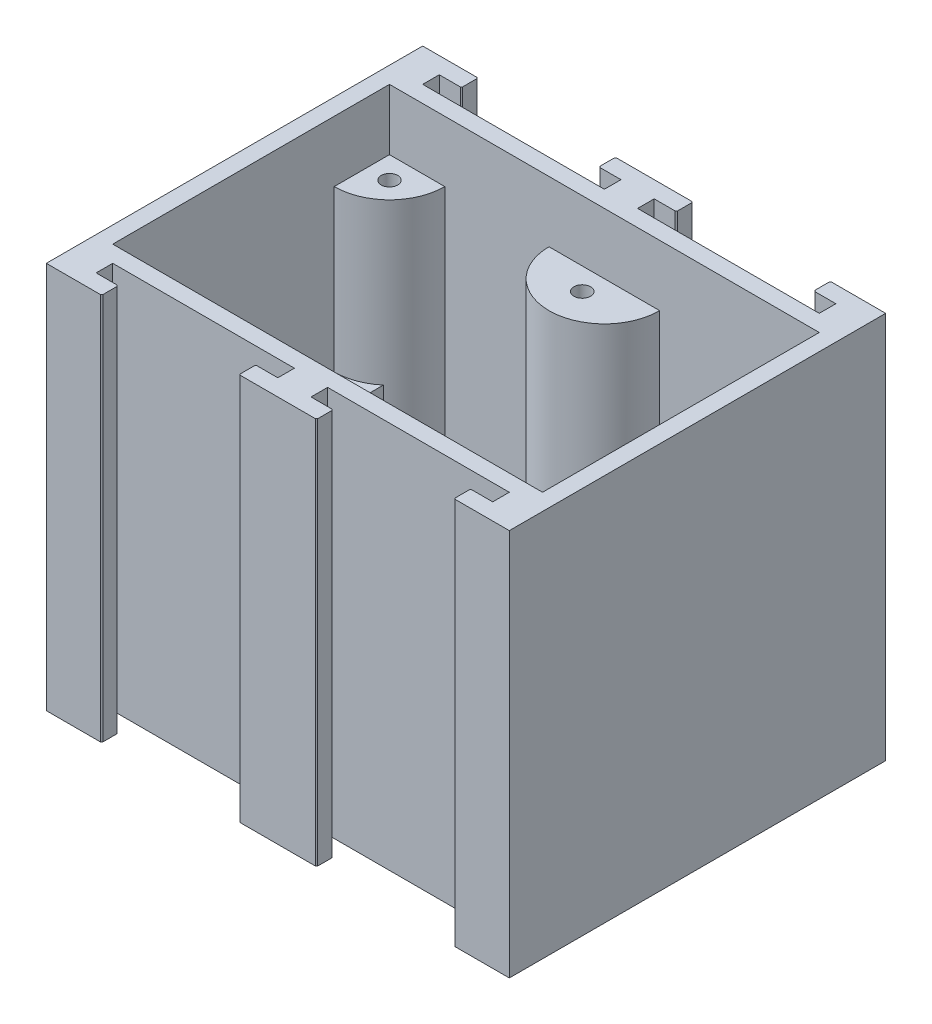
from build123d import *

# Parameters (mm, degrees)
SKETCH1_R             = 1.5
BOSS_EXTRUDE6_DEPTH   = 59
BOSS_EXTRUDE6_2_DEPTH = 59
BOSS_EXTRUDE6_3_DEPTH = 59
BOSS_EXTRUDE6_4_DEPTH = 59
BOSS_EXTRUDE6_5_DEPTH = 59
BOSS_EXTRUDE6_6_DEPTH = 59
SKETCH2_W             = 83.65
SKETCH2_H             = 56
SKETCH2_W_2           = 77.65
SKETCH2_H_2           = 50
BOSS_EXTRUDE7_DEPTH   = 70
SKETCH3_R             = 2.1
SKETCH3_W             = 8
SKETCH3_H             = 50
BOSS_EXTRUDE8_DEPTH   = 30
CHAMFER1_SIZE         = 3
FILLET1_R             = 3
SKETCH4_R             = 2.1
CUT_EXTRUDE2_DEPTH    = 16
FILLET2_R             = 1.3
SKETCH5_W             = 8.8
SKETCH5_H             = 12
CUT_EXTRUDE3_DEPTH    = 10
FILLET3_R             = 0.6
SKETCH6_W             = 6
SKETCH6_H             = 6
BOSS_EXTRUDE9_DEPTH   = 70
CHAMFER3_SIZE         = 0.2


with BuildPart() as part:
    # Sketch1 → Boss-Extrude6 (new body)
    with BuildSketch(Plane(origin=(0, 0, 0), x_dir=(1, 0, 0), z_dir=(0, 1, 0))):
        with BuildLine():
            Line((-38.825, 15), (-38.825, 25))
            Line((-38.825, 25), (-28.825, 25))
            ThreePointArc((-28.825, 25), (-31.753932188, 17.928932188), (-38.825, 15))
        make_face()
        with Locations(Location((-34.825, 21, 0), (0, 0, 270))):
            Circle(SKETCH1_R, mode=Mode.SUBTRACT)
    extrude(amount=BOSS_EXTRUDE6_DEPTH)



with BuildPart() as body_2:
    # Sketch1 → Boss-Extrude6 2 (new body)
    with BuildSketch(Plane(origin=(0, 0, 0), x_dir=(1, 0, 0), z_dir=(0, 1, 0))):
        with BuildLine():
            Line((-38.825, -25), (-28.825, -25))
            ThreePointArc((-28.825, -25), (-31.753932188, -17.928932188), (-38.825, -15))
            Line((-38.825, -15), (-38.825, -25))
        make_face()
        with Locations(Location((-34.825, -21, 0), (0, 0, 270))):
            Circle(SKETCH1_R, mode=Mode.SUBTRACT)
    extrude(amount=BOSS_EXTRUDE6_2_DEPTH)


with BuildPart() as body_3:
    # Sketch1 → Boss-Extrude6 3 (new body)
    with BuildSketch(Plane(origin=(0, 0, 0), x_dir=(1, 0, 0), z_dir=(0, 1, 0))):
        with BuildLine():
            Line((38.825, -25), (38.825, -15))
            ThreePointArc((38.825, -15), (31.753932188, -17.928932188), (28.825, -25))
            Line((28.825, -25), (38.825, -25))
        make_face()
        with Locations(Location((34.825, -21, 0), (0, 0, 270))):
            Circle(SKETCH1_R, mode=Mode.SUBTRACT)
    extrude(amount=BOSS_EXTRUDE6_3_DEPTH)


with BuildPart() as body_4:
    # Sketch1 → Boss-Extrude6 4 (new body)
    with BuildSketch(Plane(origin=(0, 0, 0), x_dir=(1, 0, 0), z_dir=(0, 1, 0))):
        with BuildLine():
            Line((28.825, 25), (38.825, 25))
            Line((38.825, 25), (38.825, 15))
            ThreePointArc((38.825, 15), (31.753932188, 17.928932188), (28.825, 25))
        make_face()
        with Locations(Location((34.825, 21, 0), (0, 0, 270))):
            Circle(SKETCH1_R, mode=Mode.SUBTRACT)
    extrude(amount=BOSS_EXTRUDE6_4_DEPTH)


with BuildPart() as body_5:
    # Sketch1 → Boss-Extrude6 5 (new body)
    with BuildSketch(Plane(origin=(0, 0, 0), x_dir=(1, 0, 0), z_dir=(0, 1, 0))):
        with BuildLine():
            Line((10, -25), (-10, -25))
            ThreePointArc((-10, -25), (0, -15), (10, -25))
        make_face()
        with Locations(Location((0, -21, 0), (0, 0, 270))):
            Circle(SKETCH1_R, mode=Mode.SUBTRACT)
    extrude(amount=BOSS_EXTRUDE6_5_DEPTH)


with BuildPart() as body_6:
    # Sketch1 → Boss-Extrude6 6 (new body)
    with BuildSketch(Plane(origin=(0, 0, 0), x_dir=(1, 0, 0), z_dir=(0, 1, 0))):
        with BuildLine():
            Line((10, 25), (-10, 25))
            ThreePointArc((-10, 25), (0, 15), (10, 25))
        make_face()
        with Locations(Location((0, 21, 0), (0, 0, 270))):
            Circle(SKETCH1_R, mode=Mode.SUBTRACT)
    extrude(amount=BOSS_EXTRUDE6_6_DEPTH)


with BuildPart() as part_1:
    add(part.part)

    add(body_2.part)  # Boss-Extrude7 merges body 2

    add(body_3.part)  # Boss-Extrude7 merges body 3

    add(body_4.part)  # Boss-Extrude7 merges body 4

    add(body_5.part)  # Boss-Extrude7 merges body 5

    add(body_6.part)  # Boss-Extrude7 merges body 6
    # Sketch2 → Boss-Extrude7 (add)
    with BuildSketch(Plane(origin=(0, 0, 0), x_dir=(1, 0, 0), z_dir=(0, 1, 0))):
        Rectangle(SKETCH2_W, SKETCH2_H)
        Rectangle(SKETCH2_W_2, SKETCH2_H_2, mode=Mode.SUBTRACT)
    extrude(amount=BOSS_EXTRUDE7_DEPTH)

    # Sketch3 → Boss-Extrude8 (add)
    # profile 1 of 2: a face of its own
    with BuildSketch(Plane(origin=(0, 0, 0), x_dir=(1, 0, 0), z_dir=(0, 1, 0))):
        Polygon((-38.825, 0), (-38.825, 19), (-32.325, 19), (-32.325, -19), (-38.825, -19), align=None)
        with Locations(Location((-35.925, 4.8, 0), (0, 0, 270))):
            Circle(SKETCH3_R, mode=Mode.SUBTRACT)
        with Locations(Location((-35.925, -4.8, 0), (0, 0, 90))):
            Circle(SKETCH3_R, mode=Mode.SUBTRACT)
    # profile 2 of 2: a face of its own
    with BuildSketch(Plane(origin=(0, 0, 0), x_dir=(1, 0, 0), z_dir=(0, 1, 0))):
        with Locations((13.299000327, 0)):
            Rectangle(SKETCH3_W, SKETCH3_H)
        with Locations(Location((12.899000327, -4.8, 0), (0, 0, 270))):
            Circle(SKETCH3_R, mode=Mode.SUBTRACT)
        with Locations(Location((12.899000327, 4.8, 0), (0, 0, 90))):
            Circle(SKETCH3_R, mode=Mode.SUBTRACT)
    extrude(amount=BOSS_EXTRUDE8_DEPTH)

    # Chamfer1
    chamfer1_edges = [part_1.edges().sort_by_distance(p)[0] for p in [
        (13.649500163, 30, 25),
        (13.649500163, 30, -25),
        (17.299000327, 15, -25),
        (17.299000327, 15, 25),
    ]]
    chamfer(chamfer1_edges, length=CHAMFER1_SIZE)

    # Fillet1
    fillet1_edges = [part_1.edges().sort_by_distance(p)[0] for p in [
        (9.299000327, 15, -21.32187644),
        (9.299000327, 15, 21.32187644),
    ]]
    fillet(fillet1_edges, radius=FILLET1_R)

    # Sketch4 → Cut-Extrude2 (cut)
    # profile 1 of 4: a face of its own
    with BuildSketch(Plane.XZ):
        Polygon((-32.325, 4.035382907), (-32.325, 5.564617093), (-33.904274058, 8.3), (-37.945725942, 8.3), (-39.966451884, 4.8), (-37.945725942, 1.3), (-33.904274058, 1.3), align=None)
        with Locations(Location((-35.925, 4.8, 0), (0, 0, 270))):
            Circle(SKETCH4_R, mode=Mode.SUBTRACT)
    # profile 2 of 4: a face of its own
    with BuildSketch(Plane.XZ):
        Polygon((-32.325, -5.564617093), (-32.325, -4.035382907), (-33.904274058, -1.3), (-37.945725942, -1.3), (-39.966451884, -4.8), (-37.945725942, -8.3), (-33.904274058, -8.3), align=None)
        with Locations(Location((-35.925, -4.8, 0), (0, 0, 270))):
            Circle(SKETCH4_R, mode=Mode.SUBTRACT)
    # profile 3 of 4: a face of its own
    with BuildSketch(Plane.XZ):
        Polygon((10.878274385, -1.3), (9.299000327, -4.035382907), (9.299000327, -5.564617093), (10.878274385, -8.3), (14.919726269, -8.3), (16.940452211, -4.8), (14.919726269, -1.3), align=None)
        with Locations(Location((12.899000327, -4.8, 0), (0, 0, 270))):
            Circle(SKETCH4_R, mode=Mode.SUBTRACT)
    # profile 4 of 4: a face of its own
    with BuildSketch(Plane.XZ):
        Polygon((14.919726269, 1.3), (16.940452211, 4.8), (14.919726269, 8.3), (10.878274385, 8.3), (9.299000327, 5.564617093), (9.299000327, 4.035382907), (10.878274385, 1.3), align=None)
        with Locations(Location((12.899000327, 4.8, 0), (0, 0, 270))):
            Circle(SKETCH4_R, mode=Mode.SUBTRACT)
    extrude(amount=-CUT_EXTRUDE2_DEPTH, mode=Mode.SUBTRACT)

    # Fillet2
    # the kernel refuses this fillet: 1.3 mm, written as the material it takes off along each edge
    with BuildSketch(Plane(origin=(9.299000327, -10.012577226, -5.564617093), x_dir=(0.5000000000000003, 0, -0.8660254037844384), z_dir=(0, 1, 0)), Plane(origin=(9.299000327, -10.012577226, 4.035382907), x_dir=(0.5000000000000006, 0, -0.8660254037844383), z_dir=(0, 1, 0)), Plane(origin=(-32.325, -10.012577226, 5.564617093), x_dir=(-0.4999999999999981, 0, 0.8660254037844398), z_dir=(0, 1, 0)), Plane(origin=(-32.325, -10.012577226, -4.035382907), x_dir=(-0.5000000000000001, 0, 0.8660254037844386), z_dir=(0, 1, 0))) as fillet2_piece_1:
        with BuildLine():
            CenterArc((4.118458494, 0.87668242), FILLET2_R, 120, 102.405330947)
            Line((3.468458494, 2.002515445), (0, 0))
            Line((0, 0), (3.158548116, 0))
        make_face()
    extrude(amount=26.012577226, mode=Mode.SUBTRACT)
    with BuildSketch(Plane(origin=(9.299000327, -10.012577226, -4.035382907), x_dir=(0.4999999999999997, 0, 0.8660254037844388), z_dir=(0, 1, 0)), Plane(origin=(9.299000327, -10.012577226, 5.564617093), x_dir=(0.49999999999999944, 0, 0.866025403784439), z_dir=(0, 1, 0)), Plane(origin=(-32.325, -10.012577226, -5.564617093), x_dir=(-0.5000000000000004, 0, -0.8660254037844384), z_dir=(0, 1, 0)), Plane(origin=(-32.325, -10.012577226, 4.035382907), x_dir=(-0.5000000000000004, 0, -0.8660254037844383), z_dir=(0, 1, 0))) as fillet2_piece_2:
        with BuildLine():
            CenterArc((4.118458494, -0.87668242), FILLET2_R, 137.594669053, 102.405330947)
            Line((3.468458494, -2.002515445), (0, 0))
            Line((0, 0), (3.158548116, 0))
        make_face()
    extrude(amount=26.012577226, mode=Mode.SUBTRACT)

    # Sketch5 → Cut-Extrude3 (cut)
    with BuildSketch(Plane.XZ):
        with Locations((12.899000327, 0)):
            Rectangle(SKETCH5_W, SKETCH5_H)
        with Locations((-35.925, 0)):
            Rectangle(SKETCH5_W, SKETCH5_H)
    extrude(amount=-CUT_EXTRUDE3_DEPTH, mode=Mode.SUBTRACT)

    # Fillet3
    fillet3_edges = [part_1.edges().sort_by_distance(p)[0] for p in [
        (16.247631888, 5, 6),
        (16.247631888, 5, -6),
        (17.299000327, 5, -6),
        (17.299000327, 5, 6),
        (-39.273631561, 5, -6),
        (-39.273631561, 5, 6),
        (-40.325, 5, 6),
        (-40.325, 5, -6),
    ]]
    fillet(fillet3_edges, radius=FILLET3_R)

    # Sketch6 → Boss-Extrude9 (add)
    with BuildSketch(Plane(origin=(0, 0, 0), x_dir=(1, 0, 0), z_dir=(0, 1, 0))):
        Polygon((-7, 31), (-3, 31), (3, 31), (7, 31), (7, 34), (-7, 34), align=None)
        with Locations((0, 28)):
            Rectangle(SKETCH6_W, SKETCH6_H)
        with Locations((-38.825, 28)):
            Rectangle(SKETCH6_W, SKETCH6_H)
        Polygon((-41.825, 31), (-35.825, 31), (-31.825, 31), (-31.825, 34), (-41.825, 34), align=None)
        Polygon((41.825, 31), (41.825, 34), (31.825, 34), (31.825, 31), (35.825, 31), align=None)
        with Locations((38.825, 28)):
            Rectangle(SKETCH6_W, SKETCH6_H)
        with Locations((38.825, -28)):
            Rectangle(SKETCH6_W, SKETCH6_H)
        Polygon((41.825, -31), (35.825, -31), (31.825, -31), (31.825, -34), (41.825, -34), align=None)
        Polygon((-41.825, -31), (-41.825, -34), (-31.825, -34), (-31.825, -31), (-35.825, -31), align=None)
        with Locations((-38.825, -28)):
            Rectangle(SKETCH6_W, SKETCH6_H)
        Polygon((-7, -34), (7, -34), (7, -31), (3, -31), (-3, -31), (-7, -31), align=None)
        with Locations((0, -28)):
            Rectangle(SKETCH6_W, SKETCH6_H)
    extrude(amount=BOSS_EXTRUDE9_DEPTH)

    # Chamfer3
    chamfer3_edges = [part_1.edges().sort_by_distance(p)[0] for p in [
        (-31.825, 35, 31),
        (-31.825, 35, 34),
        (31.825, 35, 34),
        (31.825, 35, 31),
        (-31.825, 35, -34),
        (-31.825, 35, -31),
        (-7, 35, -31),
        (-7, 35, -34),
        (7, 35, -34),
        (7, 35, -31),
        (31.825, 35, -34),
        (31.825, 35, -31),
        (-7, 35, 34),
        (7, 35, 34),
        (-7, 35, 31),
        (7, 35, 31),
    ]]
    chamfer(chamfer3_edges, length=CHAMFER3_SIZE)


solid = part_1.part
